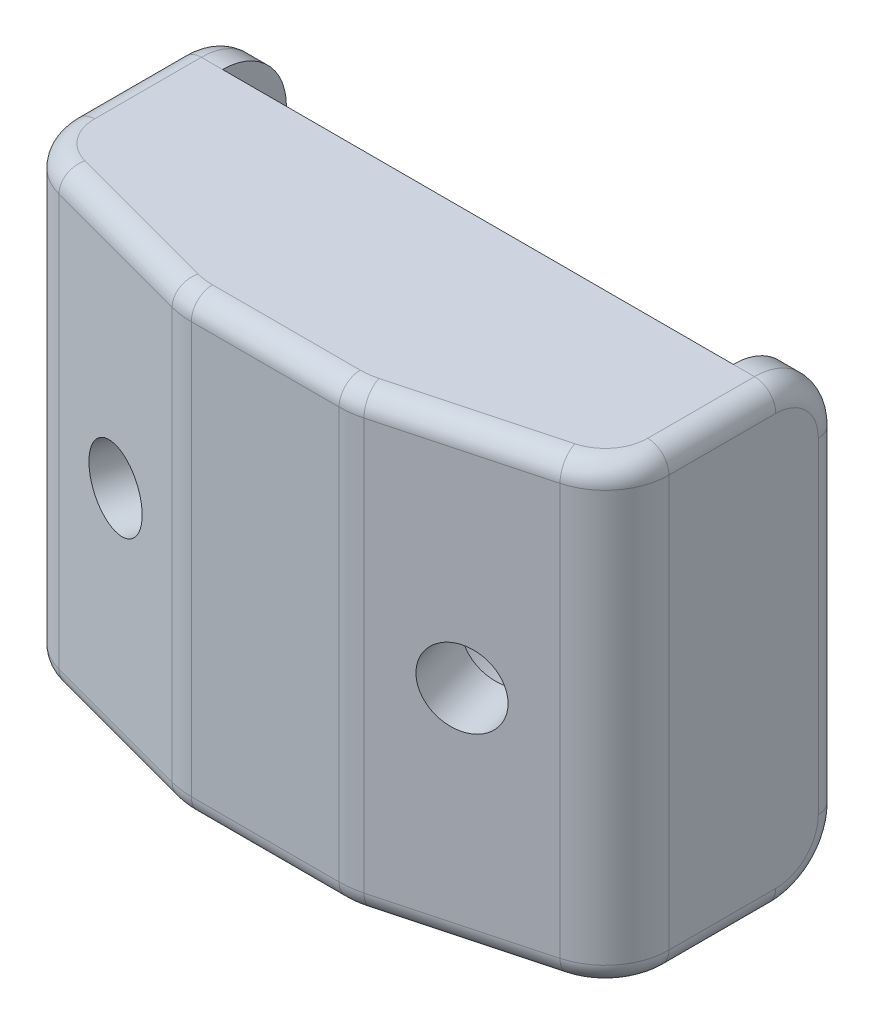
from build123d import *

# Parameters (mm, degrees)
SKETCH1_W                   = 44.45
SKETCH1_H                   = 33.86758938
SKETCH1_W_2                 = 38.1
SKETCH1_H_2                 = 32.59758938
BOSS_EXTRUDE1_DEPTH         = 6.35
SKETCH2_W                   = 44.45
SKETCH2_H                   = 33.86758938
BOSS_EXTRUDE2_DEPTH         = 9.525
CUT_EXTRUDE1_DEPTH          = 151.402114191
SKETCH4_W                   = 3.175
SKETCH4_H                   = 33.86758938
BOSS_EXTRUDE3_DEPTH         = 4.7625
SHELL2_START                = 9.24120531
SHELL2_DEPTH                = 24.34258938
FILLET4_R                   = 4.7625
FILLET1_R                   = 4.7625
FILLET3_R                   = 6.35
FILLET2_R                   = 1.5875
F_10_CLEARANCE_HOLE1_D      = 5.6134
F_10_CLEARANCE_HOLE1_DEPTH  = 7.802129636
BOSS_EXTRUDE4_REACH         = 152.369
CUT_EXTRUDE2_START          = -4.7625
SKETCH9_R                   = 6.82625
CUT_EXTRUDE2_DEPTH          = 145.161286958
HOLE1_AT_2_COUNT            = 2
HOLE1_AT_2_PITCH            = 20.32
F_1_4_CLEARANCE_HOLE1_D     = 7.14248
F_1_4_CLEARANCE_HOLE1_DEPTH = 9.652
F_1_4_CLEARANCE_HOLE1_TIP   = 2.145817477


# Read off the part's stored shape, not the designer's step: Shell2
with BuildPart() as part:
    # Sketch1 → Boss-Extrude1 (new body)
    with BuildSketch(Plane.XY):
        with Locations((124.004465969, 21.4125)):
            Rectangle(SKETCH1_W, SKETCH1_H)
        with Locations((124.004465969, 21.4125)):
            Rectangle(SKETCH1_W_2, SKETCH1_H_2, mode=Mode.SUBTRACT)
    extrude(amount=-BOSS_EXTRUDE1_DEPTH)

    # Sketch2 → Boss-Extrude2 (add)
    with BuildSketch(Plane.XY):
        with Locations((124.004465969, 21.4125)):
            Rectangle(SKETCH2_W, SKETCH2_H)
    extrude(amount=BOSS_EXTRUDE2_DEPTH)

    # Sketch3 → Cut-Extrude1 (cut, through all)
    with BuildSketch(Plane.XZ.offset(-4.47870531)):
        Polygon((130.354465969, 9.525), (146.229465969, 5.27130657), (146.229465969, 9.525), align=None)
        Polygon((101.779465969, 9.525), (117.654465969, 9.525), (101.779465969, 5.27130657), align=None)
    extrude(amount=-CUT_EXTRUDE1_DEPTH, mode=Mode.SUBTRACT)

    # Sketch4 → Boss-Extrude3 (add)
    with BuildSketch(Plane(origin=(0, 0, -6.35), x_dir=(-1, 0, 0), z_dir=(0, 0, -1))):
        with Locations((-144.641965969, 21.4125)):
            Rectangle(SKETCH4_W, SKETCH4_H)
        with Locations((-103.366965969, 21.4125)):
            Rectangle(SKETCH4_W, SKETCH4_H)
    extrude(amount=BOSS_EXTRUDE3_DEPTH)

    # Shell2 outline → Shell2 (cut)
    with BuildSketch(Plane(origin=(0, 0, 0), x_dir=(1, 0, 0), z_dir=(0, 1, 0)).offset(SHELL2_START)):
        Polygon((141.466965969, 0), (106.541965969, 0), (106.541965969, -1.61691179), (118.281460989, -4.7625), (129.727470949, -4.7625), (141.466965969, -1.61691179), align=None)
    extrude(amount=SHELL2_DEPTH, mode=Mode.SUBTRACT)

    # Fillet4
    fillet4_edges = [part.edges().sort_by_distance(p)[0] for p in [
        (144.641965969, 38.34629469, -11.1125),
        (103.366965969, 38.34629469, -11.1125),
        (144.641965969, 4.47870531, -11.1125),
        (103.366965969, 4.47870531, -11.1125),
    ]]
    fillet(fillet4_edges, radius=FILLET4_R)

    # Fillet1
    fillet1_edges = [part.edges().sort_by_distance(p)[0] for p in [
        (146.229465969, 21.4125, 5.27130657),
        (101.779465969, 21.4125, 5.27130657),
    ]]
    fillet(fillet1_edges, radius=FILLET1_R)

    # Fillet3
    fillet3_edges = [part.edges().sort_by_distance(p)[0] for p in [
        (130.354465969, 21.4125, 9.525),
        (117.654465969, 21.4125, 9.525),
    ]]
    fillet(fillet3_edges, radius=FILLET3_R)

    # Fillet2
    fillet2_edges = [part.edges().sort_by_distance(p)[0] for p in [
        (146.229465969, 21.4125, -11.1125),
        (146.229465969, 4.47870531, -2.366544105),
        (146.229465969, 38.34629469, -2.366544105),
        (146.229465969, 5.873609265, -9.717596045),
        (146.229465969, 36.951390735, -9.717596045),
        (101.779465969, 38.34629469, -2.366544105),
        (101.779465969, 21.4125, -11.1125),
        (101.779465969, 4.47870531, -2.366544105),
        (101.779465969, 5.873609265, -9.717596045),
        (101.779465969, 36.951390735, -9.717596045),
        (111.07814933, 4.47870531, 7.762881267),
        (102.763620686, 4.47870531, 4.516138096),
        (145.245311252, 4.47870531, 4.516138096),
        (111.07814933, 38.34629469, 7.762881267),
        (102.763620686, 38.34629469, 4.516138096),
        (145.245311252, 38.34629469, 4.516138096),
        (124.004465969, 38.34629469, 9.525),
        (124.004465969, 4.47870531, 9.525),
        (136.930782609, 4.47870531, 7.762881267),
        (130.34731393, 4.47870531, 9.47067487),
        (117.661618008, 4.47870531, 9.47067487),
        (136.930782609, 38.34629469, 7.762881267),
        (130.34731393, 38.34629469, 9.47067487),
        (117.661618008, 38.34629469, 9.47067487),
    ]]
    fillet(fillet2_edges, radius=FILLET2_R)

    # #10 Clearance Hole1
    with Locations(Plane(origin=(5.500104786, 0, -20.526670507), x_dir=(0.96592582628907, 0, 0.2588190451025144), z_dir=(-0.2588190451025144, 0, 0.96592582628907))):
        with Locations((109.302434691, 21.4125)):
            f_10_clearance_hole1 = Hole(F_10_CLEARANCE_HOLE1_D / 2, depth=F_10_CLEARANCE_HOLE1_DEPTH)

    # Mirror1: #10 Clearance Hole1 across plane
    add(f_10_clearance_hole1.mirror(Plane(origin=(124.004465969, 0, 0), x_dir=(0, 0, 1), z_dir=(1, 0, 0))), mode=Mode.SUBTRACT)

    # Sketch8 → Boss-Extrude4 (add, up to next)
    with BuildSketch(Plane(origin=(0, 5.11370531, 0), x_dir=(1, 0, 0), z_dir=(0, 1, 0)), mode=Mode.PRIVATE) as boss_extrude4_sk1:
        Polygon((106.541965969, 0), (106.541965969, -1.61691179), (118.281460989, -4.7625), (129.727470949, -4.7625), (141.466965969, -1.61691179), (141.466965969, 0), (143.054465969, 0), (143.054465969, 6.35), (104.954465969, 6.35), (104.954465969, 0), align=None)
    boss_extrude4_tool1 = extrude(boss_extrude4_sk1.sketch, amount=BOSS_EXTRUDE4_REACH, mode=Mode.PRIVATE) - part.part
    add(boss_extrude4_tool1.solids().sort_by_distance((124.004466, 5.113705, -1.371306))[0])

    # Sketch9 → Cut-Extrude2 (cut, through all)
    with BuildSketch(Plane(origin=(5.500104786, 0, -20.526670507), x_dir=(0.96592582628907, 0, 0.2588190451025144), z_dir=(-0.2588190451025144, 0, 0.96592582628907)).offset(CUT_EXTRUDE2_START)):
        with Locations((109.302434691, 21.4125)):
            Circle(SKETCH9_R)
    cut_extrude2 = extrude(amount=-CUT_EXTRUDE2_DEPTH, mode=Mode.SUBTRACT)

    # Mirror2: Cut-Extrude2 across plane
    add(cut_extrude2.mirror(Plane(origin=(124.004465969, 0, 0), x_dir=(0, 0, 1), z_dir=(1, 0, 0))), mode=Mode.SUBTRACT)

    # Sketch12 → Hole1 (revolve, cut)
    with BuildSketch(Plane(origin=(124.004465969, 31.5725, -6.35), x_dir=(0, 1, 0), z_dir=(1, 0, 0))):
        Polygon((0, 0), (0, 7.62), (4.4323, 7.62), (4.6101, 0), align=None)
    hole1 = revolve(axis=Axis((124.004465969, 31.5725, 103.65), (0, 0, -1)), mode=Mode.SUBTRACT)

    # Hole1 at 2: Hole1 ×2
    with Locations(*[(0, -i * HOLE1_AT_2_PITCH, 0) for i in range(1, HOLE1_AT_2_COUNT)]):
        add(hole1, mode=Mode.SUBTRACT)

    # 1/4 Clearance Hole1
    with Locations(Plane(origin=(0, 0, -6.35), x_dir=(-1, 0, 0), z_dir=(0, 0, -1))):
        with Locations((-124.004465969, 11.2525), (-124.004465969, 31.5725)):
            Hole(F_1_4_CLEARANCE_HOLE1_D / 2, depth=F_1_4_CLEARANCE_HOLE1_DEPTH)
            with Locations((0, 0, -(F_1_4_CLEARANCE_HOLE1_DEPTH + F_1_4_CLEARANCE_HOLE1_TIP / 2))):  # 118° drill point
                Cone(0, F_1_4_CLEARANCE_HOLE1_D / 2, F_1_4_CLEARANCE_HOLE1_TIP, mode=Mode.SUBTRACT)


solid = part.part
